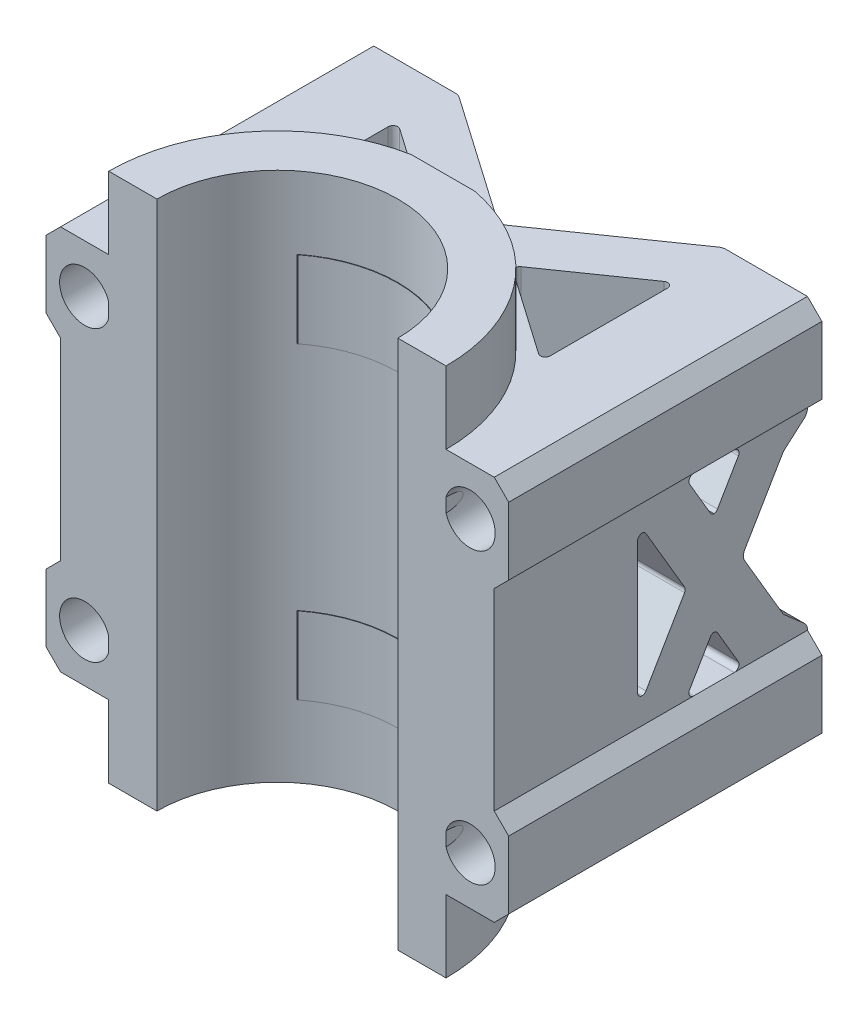
from build123d import *

# Parameters (mm, degrees)
BOSS_EXTRUDE1_DEPTH = 55
SKETCH4_R           = 2.6
BOSS_EXTRUDE2_DEPTH = 30
BOSS_EXTRUDE3_REACH = 55.686
SKETCH6_W           = 8
SKETCH6_H           = 30
BOSS_EXTRUDE4_REACH = 55.686
SKETCH7_W           = 8
SKETCH7_H           = 30
SKETCH8_W           = 20.202041029
SKETCH8_H           = 8
BOSS_EXTRUDE5_DEPTH = 29
SKETCH9_R           = 12.45
CUT_EXTRUDE1_DEPTH  = 100
CUT_EXTRUDE2_DEPTH  = 50
CUT_EXTRUDE15_DEPTH = 10
BOSS_EXTRUDE6_DEPTH = 2.5
CUT_EXTRUDE16_DEPTH = 80.01502149
CUT_EXTRUDE17_DEPTH = 63.357315313
FILLET1_R           = 1
FILLET4_R           = 0.5
SKETCH16_R          = 2.6
CUT_EXTRUDE18_DEPTH = 68.089006395


with BuildPart() as part:
    # Sketch1 → Boss-Extrude1 (new body)
    with BuildSketch(Plane(origin=(0, 0, 0), x_dir=(1, 0, 0), z_dir=(0, 1, 0))):
        with BuildLine():
            Line((-17.5, 0), (-12.5, 0))
            ThreePointArc((-12.5, 0), (-8.838834765, 8.838834765), (0, 12.5))
            ThreePointArc((0, 12.5), (8.838834765, 8.838834765), (12.5, 0))
            Line((12.5, 0), (17.5, 0))
            ThreePointArc((17.5, 0), (13.480591053, 11.1590172), (3.268724015, 17.192016848))
            Line((3.268724015, 17.192016848), (-0.344865062, 17.192016848))
            Line((-0.344865062, 17.192016848), (-3.268724015, 17.192016848))
            ThreePointArc((-3.268724015, 17.192016848), (-13.480591053, 11.1590172), (-17.5, 0))
        make_face()
    extrude(amount=BOSS_EXTRUDE1_DEPTH)

    # Sketch4 → Boss-Extrude2 (add)
    # profile 1 of 4: a face of its own
    with BuildSketch(Plane.XY):
        Polygon((-23.998641066, 16.001358934), (-22.5, 17.5), (-14.5, 17.5), (-14.5, 12.5), (-14.5, 7.5), (-22.5, 7.5), (-23.998641066, 8.998641066), align=None)
        with Locations((-19.998641066, 12.5)):
            Circle(SKETCH4_R, mode=Mode.SUBTRACT)
    # profile 2 of 4: a face of its own
    with BuildSketch(Plane.XY):
        Polygon((14.5, 7.5), (14.5, 12.5), (14.5, 17.5), (22.5, 17.5), (23.998641066, 16.001358934), (23.998641066, 8.998641066), (22.5, 7.5), align=None)
        with Locations((19.998641066, 12.5)):
            Circle(SKETCH4_R, mode=Mode.SUBTRACT)
    # profile 3 of 4: a face of its own
    with BuildSketch(Plane.XY):
        Polygon((14.5, 37.5), (14.5, 42.5), (14.5, 47.5), (22.5, 47.5), (23.998641066, 46.001358934), (23.998641066, 38.998641066), (22.5, 37.5), align=None)
        with Locations((19.998641066, 42.5)):
            Circle(SKETCH4_R, mode=Mode.SUBTRACT)
    # profile 4 of 4: a face of its own
    with BuildSketch(Plane.XY):
        Polygon((-22.5, 47.5), (-14.5, 47.5), (-14.5, 42.5), (-14.5, 37.5), (-22.5, 37.5), (-23.998641066, 38.998641066), (-23.998641066, 46.001358934), align=None)
        with Locations((-19.998641066, 42.5)):
            Circle(SKETCH4_R, mode=Mode.SUBTRACT)
    extrude(amount=-BOSS_EXTRUDE2_DEPTH)

    # Sketch6 → Boss-Extrude3 (add, up to next)
    with BuildSketch(Plane.XZ.offset(-37.5), mode=Mode.PRIVATE) as boss_extrude3_sk1:
        with Locations((-18.5, -15)):
            Rectangle(SKETCH6_W, SKETCH6_H)
    boss_extrude3_tool1 = extrude(boss_extrude3_sk1.sketch, amount=BOSS_EXTRUDE3_REACH, mode=Mode.PRIVATE) - part.part
    add(boss_extrude3_tool1.solids().sort_by_distance((-18.5, 37.5, -15))[0])

    # Sketch7 → Boss-Extrude4 (add, up to next)
    with BuildSketch(Plane.XZ.offset(-37.5), mode=Mode.PRIVATE) as boss_extrude4_sk1:
        with Locations((18.5, -15)):
            Rectangle(SKETCH7_W, SKETCH7_H)
    boss_extrude4_tool1 = extrude(boss_extrude4_sk1.sketch, amount=BOSS_EXTRUDE4_REACH, mode=Mode.PRIVATE) - part.part
    add(boss_extrude4_tool1.solids().sort_by_distance((18.5, 37.5, -15))[0])

    # Sketch8 → Boss-Extrude5 (add)
    with BuildSketch(Plane(origin=(-14.5, 0, 0), x_dir=(0, 0, -1), z_dir=(1, 0, 0))):
        with Locations((19.898979485, 11.5)):
            Rectangle(SKETCH8_W, SKETCH8_H)
        with Locations((19.898979485, 43.5)):
            Rectangle(SKETCH8_W, SKETCH8_H)
    extrude(amount=BOSS_EXTRUDE5_DEPTH)

    # Sketch9 → Cut-Extrude1 (cut)
    with BuildSketch(Plane.XZ.offset(-7.5)):
        Circle(SKETCH9_R)
    extrude(amount=-CUT_EXTRUDE1_DEPTH, mode=Mode.SUBTRACT)

    # Sketch10 → Cut-Extrude2 (cut, symmetric)
    with BuildSketch(Plane.XZ.offset(-39.5)):
        Polygon((14.5, -12.84476299), (4.37368266, -19.898979486), (14.5, -26.953195981), align=None)
        Polygon((10.12631734, -30), (0, -22.945783504), (-10.12631734, -30), align=None)
        Polygon((-14.5, -26.953195981), (-4.37368266, -19.898979486), (-14.5, -12.84476299), align=None)
    extrude(amount=CUT_EXTRUDE2_DEPTH, both=True, mode=Mode.SUBTRACT)

    # Sketch11 → Cut-Extrude15 (cut)
    with BuildSketch(Plane(origin=(-14.5, 0, 0), x_dir=(0, 0, -1), z_dir=(1, 0, 0))):
        Polygon((29.02361167, 33.15567867), (25.698913189, 27.5), (29.02361167, 21.84432133), (30, 20.184821184), (30, 22.184821184), (30, 32.816622868), (30, 34.816622868), (29.821873982, 34.513610872), align=None)
        Polygon((22.573529128, 32.816622868), (23.024363547, 32.816622868), (24.200066296, 34.816622868), (21.397826379, 34.816622868), align=None)
        Polygon((21.397826379, 34.816622868), (24.200066296, 34.816622868), (25.777493232, 37.5), (22.281875838, 37.5), (19.820399443, 37.5), align=None)
        Polygon((15.598741563, 20.184821184), (19.898979486, 27.5), (15.597892675, 34.816622868), (14.875672645, 34.816622868), (14.875672645, 20.184821184), align=None)
        Polygon((22.574378016, 22.184821184), (21.398675266, 20.184821184), (24.199217408, 20.184821184), (23.023514659, 22.184821184), align=None)
        Polygon((24.199217408, 20.184821184), (21.398675266, 20.184821184), (19.820399443, 17.5), (22.402804222, 17.5), (25.777493232, 17.5), align=None)
    cut_extrude15 = extrude(amount=-CUT_EXTRUDE15_DEPTH, mode=Mode.SUBTRACT)

    # Mirror1: Cut-Extrude15 across plane
    add(cut_extrude15.mirror(Plane(origin=(0, 0, 0), x_dir=(0, 0, 1), z_dir=(1, 0, 0))), mode=Mode.SUBTRACT)

    # Sketch12 → Boss-Extrude6 (add)
    with BuildSketch(Plane(origin=(0, 0, -30), x_dir=(-1, 0, 0), z_dir=(0, 0, -1))):
        Polygon((10.12631734, 15.5), (14.5, 15.5), (14.5, 20.184821184), (22.5, 20.184821184), (22.5, 17.5), (23.998641066, 16.001358934), (23.998641066, 8.998641066), (22.5, 7.5), (10.12631734, 7.5), align=None)
        Polygon((-22.5, 17.5), (-22.5, 20.184821184), (-14.5, 20.184821184), (-14.5, 15.5), (-10.12631734, 15.5), (-10.12631734, 7.5), (-22.5, 7.5), (-23.998641066, 8.998641066), (-23.998641066, 16.001358934), align=None)
        Polygon((-22.5, 37.5), (-23.998641066, 38.998641066), (-23.998641066, 46.001358934), (-22.5, 47.5), (-10.12631734, 47.5), (-10.12631734, 39.5), (-14.5, 39.5), (-14.5, 34.816622868), (-22.5, 34.816622868), align=None)
        Polygon((10.12631734, 47.5), (10.12631734, 39.5), (14.5, 39.5), (14.5, 34.816622868), (22.5, 34.816622868), (22.5, 37.5), (23.998641066, 38.998641066), (23.998641066, 46.001358934), (22.5, 47.5), align=None)
    extrude(amount=BOSS_EXTRUDE6_DEPTH)

    # Sketch13 → Cut-Extrude16 (cut, through all)
    with BuildSketch(Plane.ZY.offset(22.5)):
        Polygon((-32.5, 20.184821184), (-32.5, 18), (-30, 20.184821184), align=None)
        Polygon((-30, 34.816622868), (-32.5, 37), (-32.5, 34.816622868), align=None)
    extrude(amount=-CUT_EXTRUDE16_DEPTH, mode=Mode.SUBTRACT)

    # Sketch14 → Cut-Extrude17 (cut, through all)
    with BuildSketch(Plane(origin=(0, 47.5, 0), x_dir=(1, 0, 0), z_dir=(0, 1, 0))):
        Polygon((-10.12631734, 30), (-13.715063641, 32.5), (-10.12631734, 32.5), align=None)
        Polygon((10.12631734, 30), (13.715063641, 32.5), (10.12631734, 32.5), align=None)
    extrude(amount=-CUT_EXTRUDE17_DEPTH, mode=Mode.SUBTRACT)

    # Fillet1
    fillet1_edges = [part.edges().sort_by_distance(p)[0] for p in [
        (0, 43.5, -22.945783504),
        (0, 11.5, -22.945783504),
        (-18.5, 27.5, -25.698913189),
        (-18.5, 34.816622868, -30),
        (-18.5, 20.184821184, -30),
        (18.5, 27.5, -25.698913189),
        (18.5, 20.184821184, -30),
        (18.5, 34.816622868, -30),
        (18.5, 18, -32.5),
        (-18.5, 18, -32.5),
        (18.5, 37, -32.5),
        (-18.5, 37, -32.5),
        (-13.715063641, 11.5, -32.5),
        (-13.715063641, 43.5, -32.5),
        (13.715063641, 11.5, -32.5),
        (13.715063641, 43.5, -32.5),
    ]]
    fillet(fillet1_edges, radius=FILLET1_R)

    # Fillet4
    # the kernel refuses this fillet: 0.5 mm, written as the material it adds along each edge
    with BuildSketch(Plane(origin=(-14.5, 39.5, -12.84476299), x_dir=(0, 0, -1), z_dir=(0, 1, 0)), Plane(origin=(-14.5, 7.5, -26.953195981), x_dir=(0.8205319360133092, 2.8568127323077983e-15, 0.5716006840288512), z_dir=(0, 1, 0)), Plane(origin=(14.5, 47.5, -12.84476299), x_dir=(0, 0, -1), z_dir=(0, -1, 0)), Plane(origin=(14.5, 15.5, -12.84476299), x_dir=(0, 0, -1), z_dir=(0, -1, 0)), Plane(origin=(14.5, 39.5, -26.953195981), x_dir=(0, 0, 1), z_dir=(0, 1, 0)), Plane(origin=(14.5, 7.5, -26.953195981), x_dir=(0, 0, 1), z_dir=(0, 1, 0))) as fillet4_piece_1:
        with BuildLine():
            CenterArc((FILLET4_R * 1.91534371187, -FILLET4_R), FILLET4_R, 90, 124.861921912)
            Line((FILLET4_R * 1.09481177585, -FILLET4_R * 1.57160068403), (0, 0))
            Line((0, 0), (FILLET4_R * 1.91534371187, 0))
        make_face()
    extrude(amount=8)
    with BuildSketch(Plane(origin=(-14.5, 7.5, -12.84476299), x_dir=(0.8205319360133058, 2.856812732307786e-15, -0.5716006840288562), z_dir=(0, 1, 0)), Plane(origin=(-14.5, 39.5, -26.953195981), x_dir=(0, 0, 1), z_dir=(0, 1, 0))) as fillet4_piece_2:
        with BuildLine():
            CenterArc((FILLET4_R * 1.91534371187, FILLET4_R), FILLET4_R, 145.138078088, 124.861921912)
            Line((FILLET4_R * 1.09481177585, FILLET4_R * 1.57160068403), (0, 0))
            Line((0, 0), (FILLET4_R * 1.91534371187, 0))
        make_face()
    extrude(amount=8)
    with BuildSketch(Plane(origin=(-4.37368266, 47.5, -19.898979486), x_dir=(-0.8205319360133027, -2.849524944725357e-15, 0.5716006840288604), z_dir=(0, -1, 0)), Plane(origin=(4.37368266, 7.5, -19.898979486), x_dir=(0.8205319360133051, 2.849524944725366e-15, 0.5716006840288572), z_dir=(0, 1, 0))) as fillet4_piece_3:
        with BuildLine():
            CenterArc((FILLET4_R * 1.4354985201, FILLET4_R), FILLET4_R, 159.723843824, 110.276156176)
            Line((FILLET4_R * 0.497465288318, FILLET4_R * 1.34654531604), (0, 0))
            Line((0, 0), (FILLET4_R * 1.4354985201, 0))
        make_face()
    extrude(amount=8)
    with BuildSketch(Plane(origin=(-4.37368266, 15.5, -19.898979486), x_dir=(-0.8205319360133059, -2.8495249447253684e-15, -0.571600684028856), z_dir=(0, -1, 0)), Plane(origin=(4.37368266, 39.5, -19.898979486), x_dir=(0.8205319360132926, 2.8495249447253227e-15, -0.5716006840288751), z_dir=(0, 1, 0))) as fillet4_piece_4:
        with BuildLine():
            CenterArc((FILLET4_R * 1.4354985201, -FILLET4_R), FILLET4_R, 90, 110.276156176)
            Line((FILLET4_R * 0.497465288318, -FILLET4_R * 1.34654531604), (0, 0))
            Line((0, 0), (FILLET4_R * 1.4354985201, 0))
        make_face()
    extrude(amount=8)
    with BuildSketch(Plane(origin=(-14.5, 34.816622868, -15.597892675), x_dir=(0, 0, 1), z_dir=(-1, 0, 0)), Plane(origin=(14.5, 34.816622868, -15.597892675), x_dir=(-2.9909367323885665e-15, -0.8620788194223284, -0.5067742190595379), z_dir=(1, 0, 0)), Plane(origin=(14.5, 32.816622868, -23.024363547), x_dir=(0, 0, 1), z_dir=(1, 0, 0)), Plane(origin=(14.5, 22.184821184, -22.574378016), x_dir=(0, 0, -1), z_dir=(1, 0, 0))) as fillet4_piece_5:
        with BuildLine():
            CenterArc((FILLET4_R * 0.572135366081, -FILLET4_R), FILLET4_R, 90, 59.550800041)
            Line((-FILLET4_R * 0.289943453342, -FILLET4_R * 0.49322578094), (0, 0))
            Line((0, 0), (FILLET4_R * 0.572135366081, 0))
        make_face()
    extrude(amount=8)
    with BuildSketch(Plane(origin=(-14.5, 27.5, -19.898979486), x_dir=(2.990936732388565e-15, -0.862078819422328, 0.5067742190595386), z_dir=(-1, 0, 0))) as fillet4_piece_6:
        with BuildLine():
            CenterArc((FILLET4_R * 0.587851374656, FILLET4_R), FILLET4_R, 209.101600081, 60.898399919)
            Line((-FILLET4_R * 0.285907266305, FILLET4_R * 0.513640218207), (0, 0))
            Line((0, 0), (FILLET4_R * 0.587851374656, 0))
        make_face()
    extrude(amount=8)
    with BuildSketch(Plane(origin=(-14.5, 20.184821184, -15.598741563), x_dir=(0, 0, 1), z_dir=(-1, 0, 0)), Plane(origin=(-14.5, 32.816622868, -23.024363547), x_dir=(0, 0, 1), z_dir=(-1, 0, 0)), Plane(origin=(-14.5, 32.816622868, -22.573529128), x_dir=(-2.990936732388557e-15, 0.8620788194223257, 0.5067742190595426), z_dir=(-1, 0, 0)), Plane(origin=(-14.5, 22.184821184, -23.023514659), x_dir=(2.990936732388576e-15, -0.8620788194223311, -0.5067742190595332), z_dir=(-1, 0, 0)), Plane(origin=(-14.5, 22.184821184, -22.574378016), x_dir=(0, 0, -1), z_dir=(-1, 0, 0)), Plane(origin=(14.5, 20.184821184, -15.598741563), x_dir=(2.990936732388546e-15, 0.8620788194223225, -0.5067742190595479), z_dir=(1, 0, 0)), Plane(origin=(14.5, 32.816622868, -22.573529128), x_dir=(0, 0, -1), z_dir=(1, 0, 0)), Plane(origin=(14.5, 22.184821184, -23.023514659), x_dir=(0, 0, 1), z_dir=(1, 0, 0))) as fillet4_piece_7:
        with BuildLine():
            CenterArc((FILLET4_R * 0.572135366081, FILLET4_R), FILLET4_R, 210.449199959, 59.550800041)
            Line((-FILLET4_R * 0.289943453342, FILLET4_R * 0.49322578094), (0, 0))
            Line((0, 0), (FILLET4_R * 0.572135366081, 0))
        make_face()
    extrude(amount=8)
    with BuildSketch(Plane(origin=(-14.5, 20.184821184, -14.875672645), x_dir=(0, 0, -1), z_dir=(-1, 0, 0)), Plane(origin=(-14.5, 34.816622868, -14.875672645), x_dir=(0, -1, 0), z_dir=(-1, 0, 0))) as fillet4_piece_8:
        with BuildLine():
            CenterArc((FILLET4_R, -FILLET4_R), FILLET4_R, 90, 90)
            Line((0, -FILLET4_R), (0, 0))
            Line((0, 0), (FILLET4_R, 0))
        make_face()
    extrude(amount=8)
    with BuildSketch(Plane(origin=(-14.5, 37.5, -19.820399443), x_dir=(2.9909367323885563e-15, -0.8620788194223254, -0.5067742190595429), z_dir=(-1, 0, 0))) as fillet4_piece_9_section:
        with BuildLine():
            CenterArc((FILLET4_R * 1.74783811539, -FILLET4_R), FILLET4_R, 90, 120.449199959)
            Line((FILLET4_R * 0.885759295971, -FILLET4_R * 1.50677421906), (0, 0))
            Line((0, 0), (FILLET4_R * 1.74783811539, 0))
        make_face()
    fillet4_piece_9 = extrude(amount=8, mode=Mode.PRIVATE)
    fillet4_piece_9 = split(fillet4_piece_9, bisect_by=Plane(origin=(-20.363529136, 35.363529136, -20.144307431), z_dir=(0.7071067811865483, 0.7071067811865467, 0)), keep=Keep.TOP, mode=Mode.PRIVATE)
    add(fillet4_piece_9)
    with BuildSketch(Plane(origin=(-14.5, 37.5, -19.820399443), x_dir=(2.9909367323885563e-15, -0.8620788194223254, -0.5067742190595429), z_dir=(-1, 0, 0))) as fillet4_piece_10_section:
        with BuildLine():
            CenterArc((FILLET4_R * 1.74783811539, -FILLET4_R), FILLET4_R, 90, 120.449199959)
            Line((FILLET4_R * 0.885759295971, -FILLET4_R * 1.50677421906), (0, 0))
            Line((0, 0), (FILLET4_R * 1.74783811539, 0))
        make_face()
    fillet4_piece_10 = extrude(amount=8, mode=Mode.PRIVATE)
    fillet4_piece_10 = split(fillet4_piece_10, bisect_by=Plane(origin=(-22.257808065, 37.257808065, -20.13165213), z_dir=(-0.7071067811865483, -0.7071067811865467, 0)), keep=Keep.TOP, mode=Mode.PRIVATE)
    add(fillet4_piece_10)
    with BuildSketch(Plane(origin=(-14.5, 37.5, -25.777493232), x_dir=(0, 0, 1), z_dir=(-1, 0, 0))) as fillet4_piece_11_section:
        with BuildLine():
            CenterArc((FILLET4_R * 1.74783811539, -FILLET4_R), FILLET4_R, 90, 120.449199959)
            Line((FILLET4_R * 0.885759295971, -FILLET4_R * 1.50677421906), (0, 0))
            Line((0, 0), (FILLET4_R * 1.74783811539, 0))
        make_face()
    fillet4_piece_11 = extrude(amount=8, mode=Mode.PRIVATE)
    fillet4_piece_11 = split(fillet4_piece_11, bisect_by=Plane(origin=(-20.363529136, 35.363529136, -25.453585244), z_dir=(0.7071067811865483, 0.7071067811865467, 0)), keep=Keep.TOP, mode=Mode.PRIVATE)
    add(fillet4_piece_11)
    with BuildSketch(Plane(origin=(-14.5, 37.5, -25.777493232), x_dir=(0, 0, 1), z_dir=(-1, 0, 0))) as fillet4_piece_12_section:
        with BuildLine():
            CenterArc((FILLET4_R * 1.74783811539, -FILLET4_R), FILLET4_R, 90, 120.449199959)
            Line((FILLET4_R * 0.885759295971, -FILLET4_R * 1.50677421906), (0, 0))
            Line((0, 0), (FILLET4_R * 1.74783811539, 0))
        make_face()
    fillet4_piece_12 = extrude(amount=8, mode=Mode.PRIVATE)
    fillet4_piece_12 = split(fillet4_piece_12, bisect_by=Plane(origin=(-22.257808065, 37.257808065, -25.466240545), z_dir=(-0.7071067811865483, -0.7071067811865467, 0)), keep=Keep.TOP, mode=Mode.PRIVATE)
    add(fillet4_piece_12)
    with BuildSketch(Plane(origin=(-14.5, 17.5, -25.777493232), x_dir=(-2.990936732388562e-15, 0.8620788194223271, 0.5067742190595398), z_dir=(-1, 0, 0))) as fillet4_piece_13_section:
        with BuildLine():
            CenterArc((FILLET4_R * 1.74783811539, -FILLET4_R), FILLET4_R, 90, 120.449199959)
            Line((FILLET4_R * 0.885759295971, -FILLET4_R * 1.50677421906), (0, 0))
            Line((0, 0), (FILLET4_R * 1.74783811539, 0))
        make_face()
    fillet4_piece_13 = extrude(amount=8, mode=Mode.PRIVATE)
    fillet4_piece_13 = split(fillet4_piece_13, bisect_by=Plane(origin=(-20.363529136, 19.636470864, -25.453585244), z_dir=(0.7071067811865451, -0.7071067811865501, 0)), keep=Keep.TOP, mode=Mode.PRIVATE)
    add(fillet4_piece_13)
    with BuildSketch(Plane(origin=(-14.5, 17.5, -25.777493232), x_dir=(-2.990936732388562e-15, 0.8620788194223271, 0.5067742190595398), z_dir=(-1, 0, 0))) as fillet4_piece_14_section:
        with BuildLine():
            CenterArc((FILLET4_R * 1.74783811539, -FILLET4_R), FILLET4_R, 90, 120.449199959)
            Line((FILLET4_R * 0.885759295971, -FILLET4_R * 1.50677421906), (0, 0))
            Line((0, 0), (FILLET4_R * 1.74783811539, 0))
        make_face()
    fillet4_piece_14 = extrude(amount=8, mode=Mode.PRIVATE)
    fillet4_piece_14 = split(fillet4_piece_14, bisect_by=Plane(origin=(-22.257808065, 17.742191935, -25.466240545), z_dir=(-0.7071067811865451, 0.7071067811865501, 0)), keep=Keep.TOP, mode=Mode.PRIVATE)
    add(fillet4_piece_14)
    with BuildSketch(Plane(origin=(-14.5, 17.5, -19.820399443), x_dir=(0, 0, -1), z_dir=(-1, 0, 0))) as fillet4_piece_15_section:
        with BuildLine():
            CenterArc((FILLET4_R * 1.74783811539, -FILLET4_R), FILLET4_R, 90, 120.449199959)
            Line((FILLET4_R * 0.885759295971, -FILLET4_R * 1.50677421906), (0, 0))
            Line((0, 0), (FILLET4_R * 1.74783811539, 0))
        make_face()
    fillet4_piece_15 = extrude(amount=8, mode=Mode.PRIVATE)
    fillet4_piece_15 = split(fillet4_piece_15, bisect_by=Plane(origin=(-20.363529136, 19.636470864, -20.144307431), z_dir=(0.7071067811865451, -0.7071067811865501, 0)), keep=Keep.TOP, mode=Mode.PRIVATE)
    add(fillet4_piece_15)
    with BuildSketch(Plane(origin=(-14.5, 17.5, -19.820399443), x_dir=(0, 0, -1), z_dir=(-1, 0, 0))) as fillet4_piece_16_section:
        with BuildLine():
            CenterArc((FILLET4_R * 1.74783811539, -FILLET4_R), FILLET4_R, 90, 120.449199959)
            Line((FILLET4_R * 0.885759295971, -FILLET4_R * 1.50677421906), (0, 0))
            Line((0, 0), (FILLET4_R * 1.74783811539, 0))
        make_face()
    fillet4_piece_16 = extrude(amount=8, mode=Mode.PRIVATE)
    fillet4_piece_16 = split(fillet4_piece_16, bisect_by=Plane(origin=(-22.257808065, 17.742191935, -20.13165213), z_dir=(-0.7071067811865451, 0.7071067811865501, 0)), keep=Keep.TOP, mode=Mode.PRIVATE)
    add(fillet4_piece_16)
    with BuildSketch(Plane(origin=(14.5, 27.5, -19.898979486), x_dir=(-2.990936732388565e-15, -0.862078819422328, 0.5067742190595386), z_dir=(1, 0, 0))) as fillet4_piece_17:
        with BuildLine():
            CenterArc((FILLET4_R * 0.587851374656, -FILLET4_R), FILLET4_R, 90, 60.898399919)
            Line((-FILLET4_R * 0.285907266305, -FILLET4_R * 0.513640218207), (0, 0))
            Line((0, 0), (FILLET4_R * 0.587851374656, 0))
        make_face()
    extrude(amount=8)
    with BuildSketch(Plane(origin=(14.5, 34.816622868, -14.875672645), x_dir=(0, -1, 0), z_dir=(1, 0, 0)), Plane(origin=(14.5, 20.184821184, -14.875672645), x_dir=(0, 0, -1), z_dir=(1, 0, 0))) as fillet4_piece_18:
        with BuildLine():
            CenterArc((FILLET4_R, FILLET4_R), FILLET4_R, 180, 90)
            Line((0, FILLET4_R), (0, 0))
            Line((0, 0), (FILLET4_R, 0))
        make_face()
    extrude(amount=8)
    with BuildSketch(Plane(origin=(14.5, 37.5, -25.777493232), x_dir=(-2.990936732388562e-15, -0.8620788194223271, 0.5067742190595398), z_dir=(1, 0, 0))) as fillet4_piece_19_section:
        with BuildLine():
            CenterArc((FILLET4_R * 1.74783811539, -FILLET4_R), FILLET4_R, 90, 120.449199959)
            Line((FILLET4_R * 0.885759295971, -FILLET4_R * 1.50677421906), (0, 0))
            Line((0, 0), (FILLET4_R * 1.74783811539, 0))
        make_face()
    fillet4_piece_19 = extrude(amount=8, mode=Mode.PRIVATE)
    fillet4_piece_19 = split(fillet4_piece_19, bisect_by=Plane(origin=(20.363529136, 35.363529136, -25.453585244), z_dir=(-0.7071067811865483, 0.7071067811865467, 0)), keep=Keep.TOP, mode=Mode.PRIVATE)
    add(fillet4_piece_19)
    with BuildSketch(Plane(origin=(14.5, 37.5, -25.777493232), x_dir=(-2.990936732388562e-15, -0.8620788194223271, 0.5067742190595398), z_dir=(1, 0, 0))) as fillet4_piece_20_section:
        with BuildLine():
            CenterArc((FILLET4_R * 1.74783811539, -FILLET4_R), FILLET4_R, 90, 120.449199959)
            Line((FILLET4_R * 0.885759295971, -FILLET4_R * 1.50677421906), (0, 0))
            Line((0, 0), (FILLET4_R * 1.74783811539, 0))
        make_face()
    fillet4_piece_20 = extrude(amount=8, mode=Mode.PRIVATE)
    fillet4_piece_20 = split(fillet4_piece_20, bisect_by=Plane(origin=(22.257808065, 37.257808065, -25.466240545), z_dir=(0.7071067811865483, -0.7071067811865467, 0)), keep=Keep.TOP, mode=Mode.PRIVATE)
    add(fillet4_piece_20)
    with BuildSketch(Plane(origin=(14.5, 37.5, -19.820399443), x_dir=(-2.9909367323885563e-15, -0.8620788194223254, -0.5067742190595429), z_dir=(1, 0, 0))) as fillet4_piece_21_section:
        with BuildLine():
            CenterArc((FILLET4_R * 1.74783811539, FILLET4_R), FILLET4_R, 149.550800041, 120.449199959)
            Line((FILLET4_R * 0.885759295971, FILLET4_R * 1.50677421906), (0, 0))
            Line((0, 0), (FILLET4_R * 1.74783811539, 0))
        make_face()
    fillet4_piece_21 = extrude(amount=8, mode=Mode.PRIVATE)
    fillet4_piece_21 = split(fillet4_piece_21, bisect_by=Plane(origin=(20.363529136, 35.363529136, -20.144307431), z_dir=(-0.7071067811865483, 0.7071067811865467, 0)), keep=Keep.TOP, mode=Mode.PRIVATE)
    add(fillet4_piece_21)
    with BuildSketch(Plane(origin=(14.5, 37.5, -19.820399443), x_dir=(-2.9909367323885563e-15, -0.8620788194223254, -0.5067742190595429), z_dir=(1, 0, 0))) as fillet4_piece_22_section:
        with BuildLine():
            CenterArc((FILLET4_R * 1.74783811539, FILLET4_R), FILLET4_R, 149.550800041, 120.449199959)
            Line((FILLET4_R * 0.885759295971, FILLET4_R * 1.50677421906), (0, 0))
            Line((0, 0), (FILLET4_R * 1.74783811539, 0))
        make_face()
    fillet4_piece_22 = extrude(amount=8, mode=Mode.PRIVATE)
    fillet4_piece_22 = split(fillet4_piece_22, bisect_by=Plane(origin=(22.257808065, 37.257808065, -20.13165213), z_dir=(0.7071067811865483, -0.7071067811865467, 0)), keep=Keep.TOP, mode=Mode.PRIVATE)
    add(fillet4_piece_22)
    with BuildSketch(Plane(origin=(14.5, 17.5, -25.777493232), x_dir=(2.990936732388562e-15, 0.8620788194223271, 0.5067742190595398), z_dir=(1, 0, 0))) as fillet4_piece_23_section:
        with BuildLine():
            CenterArc((FILLET4_R * 1.74783811539, FILLET4_R), FILLET4_R, 149.550800041, 120.449199959)
            Line((FILLET4_R * 0.885759295971, FILLET4_R * 1.50677421906), (0, 0))
            Line((0, 0), (FILLET4_R * 1.74783811539, 0))
        make_face()
    fillet4_piece_23 = extrude(amount=8, mode=Mode.PRIVATE)
    fillet4_piece_23 = split(fillet4_piece_23, bisect_by=Plane(origin=(20.363529136, 19.636470864, -25.453585244), z_dir=(-0.7071067811865451, -0.7071067811865501, 0)), keep=Keep.TOP, mode=Mode.PRIVATE)
    add(fillet4_piece_23)
    with BuildSketch(Plane(origin=(14.5, 17.5, -25.777493232), x_dir=(2.990936732388562e-15, 0.8620788194223271, 0.5067742190595398), z_dir=(1, 0, 0))) as fillet4_piece_24_section:
        with BuildLine():
            CenterArc((FILLET4_R * 1.74783811539, FILLET4_R), FILLET4_R, 149.550800041, 120.449199959)
            Line((FILLET4_R * 0.885759295971, FILLET4_R * 1.50677421906), (0, 0))
            Line((0, 0), (FILLET4_R * 1.74783811539, 0))
        make_face()
    fillet4_piece_24 = extrude(amount=8, mode=Mode.PRIVATE)
    fillet4_piece_24 = split(fillet4_piece_24, bisect_by=Plane(origin=(22.257808065, 17.742191935, -25.466240545), z_dir=(0.7071067811865451, 0.7071067811865501, 0)), keep=Keep.TOP, mode=Mode.PRIVATE)
    add(fillet4_piece_24)
    with BuildSketch(Plane(origin=(14.5, 17.5, -19.820399443), x_dir=(2.9909367323885657e-15, 0.8620788194223282, -0.5067742190595381), z_dir=(1, 0, 0))) as fillet4_piece_25_section:
        with BuildLine():
            CenterArc((FILLET4_R * 1.74783811539, -FILLET4_R), FILLET4_R, 90, 120.449199959)
            Line((FILLET4_R * 0.885759295971, -FILLET4_R * 1.50677421906), (0, 0))
            Line((0, 0), (FILLET4_R * 1.74783811539, 0))
        make_face()
    fillet4_piece_25 = extrude(amount=8, mode=Mode.PRIVATE)
    fillet4_piece_25 = split(fillet4_piece_25, bisect_by=Plane(origin=(20.363529136, 19.636470864, -20.144307431), z_dir=(-0.7071067811865451, -0.7071067811865501, 0)), keep=Keep.TOP, mode=Mode.PRIVATE)
    add(fillet4_piece_25)
    with BuildSketch(Plane(origin=(14.5, 17.5, -19.820399443), x_dir=(2.9909367323885657e-15, 0.8620788194223282, -0.5067742190595381), z_dir=(1, 0, 0))) as fillet4_piece_26_section:
        with BuildLine():
            CenterArc((FILLET4_R * 1.74783811539, -FILLET4_R), FILLET4_R, 90, 120.449199959)
            Line((FILLET4_R * 0.885759295971, -FILLET4_R * 1.50677421906), (0, 0))
            Line((0, 0), (FILLET4_R * 1.74783811539, 0))
        make_face()
    fillet4_piece_26 = extrude(amount=8, mode=Mode.PRIVATE)
    fillet4_piece_26 = split(fillet4_piece_26, bisect_by=Plane(origin=(22.257808065, 17.742191935, -20.13165213), z_dir=(0.7071067811865451, 0.7071067811865501, 0)), keep=Keep.TOP, mode=Mode.PRIVATE)
    add(fillet4_piece_26)

    # Sketch16 → Cut-Extrude18 (cut, through all)
    with BuildSketch(Plane.XY.offset(-30)):
        with Locations((-19.998641066, 42.5)):
            Circle(SKETCH16_R)
        with Locations((19.998641066, 42.5)):
            Circle(SKETCH16_R)
        with Locations((-19.998641066, 12.5)):
            Circle(SKETCH16_R)
        with Locations((19.998641066, 12.5)):
            Circle(SKETCH16_R)
    extrude(amount=-CUT_EXTRUDE18_DEPTH, mode=Mode.SUBTRACT)


solid = part.part
